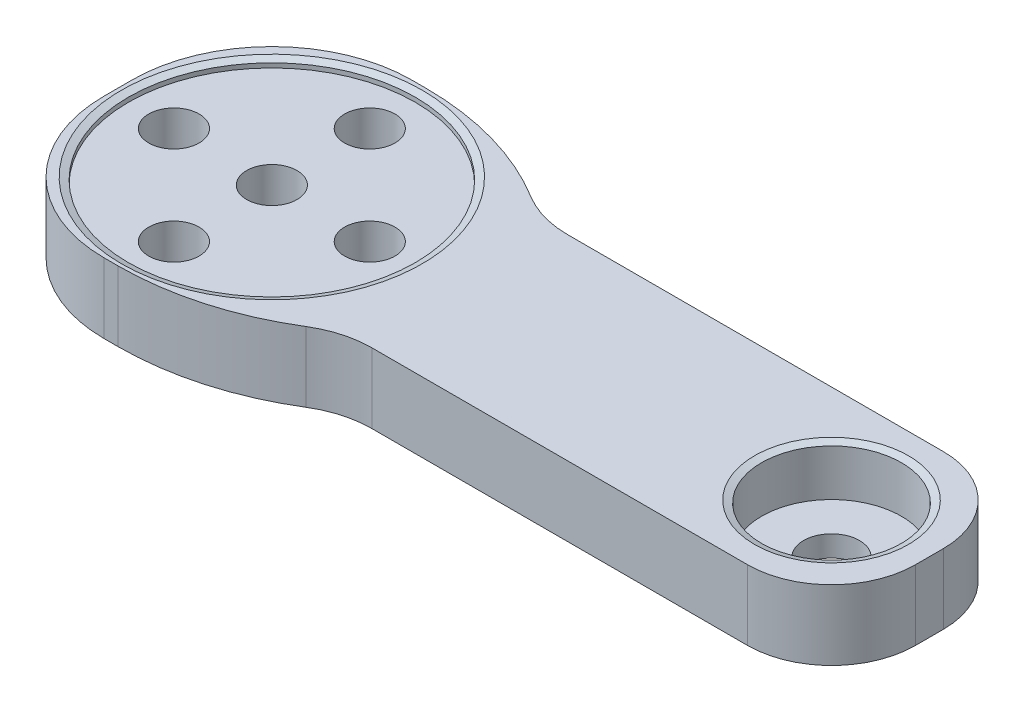
from build123d import *

# Parameters (mm, degrees)
SKETCH_2_W          = 58
SKETCH_2_H          = 22
EXTRUDE_1_DEPTH     = 5
SKETCH_4_R          = 10.25
SKETCH_4_R_2        = 1.8
CUT_EXTRUDE_1_DEPTH = 0.5
SKETCH_4_3_R        = 1.8
CUT_EXTRUDE_2_DEPTH = 10
SKETCH_5_W          = 35
SKETCH_5_H          = 4
CUT_EXTRUDE_3_DEPTH = 10
SKETCH_6_R          = 5
CUT_EXTRUDE_4_DEPTH = 3.5
CHAMFER_1_SIZE      = 0.5
CHAMFER_1_SIZE2     = 0.181985117
SKETCH_7_R          = 2
CUT_EXTRUDE_5_DEPTH = 3.5
FILLET_2_R          = 10
FILLET_3_R          = 6
FILLET_4_R          = 20
FILLET_5_R          = 7


with BuildPart() as part:
    # Эскиз2 → Бобышка-Вытянуть1 (new body)
    with BuildSketch(Plane(origin=(0, 0, 0), x_dir=(1, 0, 0), z_dir=(0, 1, 0))):
        Rectangle(SKETCH_2_W, SKETCH_2_H)
    extrude(amount=EXTRUDE_1_DEPTH)

    # Эскиз4 → Вырез-Вытянуть1 (cut)
    with BuildSketch(Plane(origin=(0, 5, 0), x_dir=(1, 0, 0), z_dir=(0, 1, 0))):
        with Locations(Location((-18, 0, 0), (0, 0, 270))):
            Circle(SKETCH_4_R)
        with Locations(Location((-18, 7, 0), (0, 0, 270))):
            Circle(SKETCH_4_R_2, mode=Mode.SUBTRACT)
        with Locations(Location((-18, -7, 0), (0, 0, 270))):
            Circle(SKETCH_4_R_2, mode=Mode.SUBTRACT)
        with Locations(Location((-25, 0, 0), (0, 0, 270))):
            Circle(SKETCH_4_R_2, mode=Mode.SUBTRACT)
        with Locations(Location((-11, 0, 0), (0, 0, 270))):
            Circle(SKETCH_4_R_2, mode=Mode.SUBTRACT)
        with Locations(Location((-18, 0, 0), (0, 0, 270))):
            Circle(SKETCH_4_R_2, mode=Mode.SUBTRACT)
    extrude(amount=-CUT_EXTRUDE_1_DEPTH, mode=Mode.SUBTRACT)

    # Эскиз4<3> → Вырез-Вытянуть2 (cut)
    with BuildSketch(Plane(origin=(0, 5, 0), x_dir=(1, 0, 0), z_dir=(0, 1, 0))):
        with Locations(Location((-18, 7, 0), (0, 0, 270))):
            Circle(SKETCH_4_3_R)
        with Locations(Location((-11, 0, 0), (0, 0, 270))):
            Circle(SKETCH_4_3_R)
        with Locations(Location((-18, -7, 0), (0, 0, 270))):
            Circle(SKETCH_4_3_R)
        with Locations(Location((-25, 0, 0), (0, 0, 270))):
            Circle(SKETCH_4_3_R)
        with Locations(Location((-18, 0, 0), (0, 0, 270))):
            Circle(SKETCH_4_3_R)
    extrude(amount=-CUT_EXTRUDE_2_DEPTH, mode=Mode.SUBTRACT)

    # Эскиз5 → Вырез-Вытянуть3 (cut)
    with BuildSketch(Plane(origin=(0, 5, 0), x_dir=(1, 0, 0), z_dir=(0, 1, 0))):
        with Locations((11.5, 9)):
            Rectangle(SKETCH_5_W, SKETCH_5_H)
        with Locations((11.5, -9)):
            Rectangle(SKETCH_5_W, SKETCH_5_H)
    extrude(amount=-CUT_EXTRUDE_3_DEPTH, mode=Mode.SUBTRACT)

    # Эскиз6 → Вырез-Вытянуть4 (cut)
    with BuildSketch(Plane(origin=(0, 5, 0), x_dir=(1, 0, 0), z_dir=(0, 1, 0))):
        with Locations(Location((22, 0, 0), (0, 0, 270))):
            Circle(SKETCH_6_R)
    extrude(amount=-CUT_EXTRUDE_4_DEPTH, mode=Mode.SUBTRACT)

    # Фаска1
    chamfer_1_edges = [part.edges().sort_by_distance(p)[0] for p in [
        (22, 5, -5),
        (-18, 5, -10.25),
    ]]
    chamfer_1_side = [part.faces().sort_by_distance(p)[0] for p in [
        (1.690967292, 5, 0),
    ]]
    chamfer(chamfer_1_edges, length=CHAMFER_1_SIZE, length2=CHAMFER_1_SIZE2, reference=chamfer_1_side[0])

    # Эскиз7 → Вырез-Вытянуть5 (cut)
    with BuildSketch(Plane(origin=(0, 1.5, 0), x_dir=(1, 0, 0), z_dir=(0, 1, 0))):
        with Locations(Location((22, 0, 0), (0, 0, 270))):
            Circle(SKETCH_7_R)
    extrude(amount=-CUT_EXTRUDE_5_DEPTH, mode=Mode.SUBTRACT)

    # Скругление2
    fillet_2_edges = [part.edges().sort_by_distance(p)[0] for p in [
        (-29, 2.5, 11),
        (-29, 2.5, -11),
    ]]
    fillet(fillet_2_edges, radius=FILLET_2_R)

    # Скругление3
    fillet_3_edges = [part.edges().sort_by_distance(p)[0] for p in [
        (29, 2.5, -7),
        (29, 2.5, 7),
    ]]
    fillet(fillet_3_edges, radius=FILLET_3_R)

    # Скругление4
    # the kernel refuses this fillet: 20 mm, written as the material it takes off along each edge
    with BuildSketch(Plane(origin=(-6, 35, -11), x_dir=(0, 0, 1), z_dir=(0, -1, 0))) as fillet_4_piece_1:
        with BuildLine():
            CenterArc((20, 12), FILLET_4_R, 180, 36.869897646)
            Line((0, 12), (-0.4, 12))
            Line((-0.4, 12), (-0.4, 0))
            Line((-0.4, 0), (0, -0.4))
            ThreePointArc((0, -0.4), (2, -0.4), (3.68, -0.24))
            Line((3.68, -0.24), (4, 0))
        make_face()
    extrude(amount=65, mode=Mode.SUBTRACT)
    with BuildSketch(Plane(origin=(-6, 35, 11), x_dir=(0, 0, -1), z_dir=(0, -1, 0))) as fillet_4_piece_2:
        with BuildLine():
            CenterArc((20, -12), FILLET_4_R, 143.130102354, 36.869897646)
            Line((0, -12), (-0.4, -12))
            Line((-0.4, -12), (-0.4, 0))
            Line((-0.4, 0), (0, 0.4))
            ThreePointArc((0, 0.4), (2, 0.4), (3.68, 0.24))
            Line((3.68, 0.24), (4, 0))
        make_face()
    extrude(amount=65, mode=Mode.SUBTRACT)

    # Скругление5
    fillet_5_edges = [part.edges().sort_by_distance(p)[0] for p in [
        (-6, 2.5, -7),
        (-6, 2.5, 7),
    ]]
    fillet(fillet_5_edges, radius=FILLET_5_R)


solid = part.part
